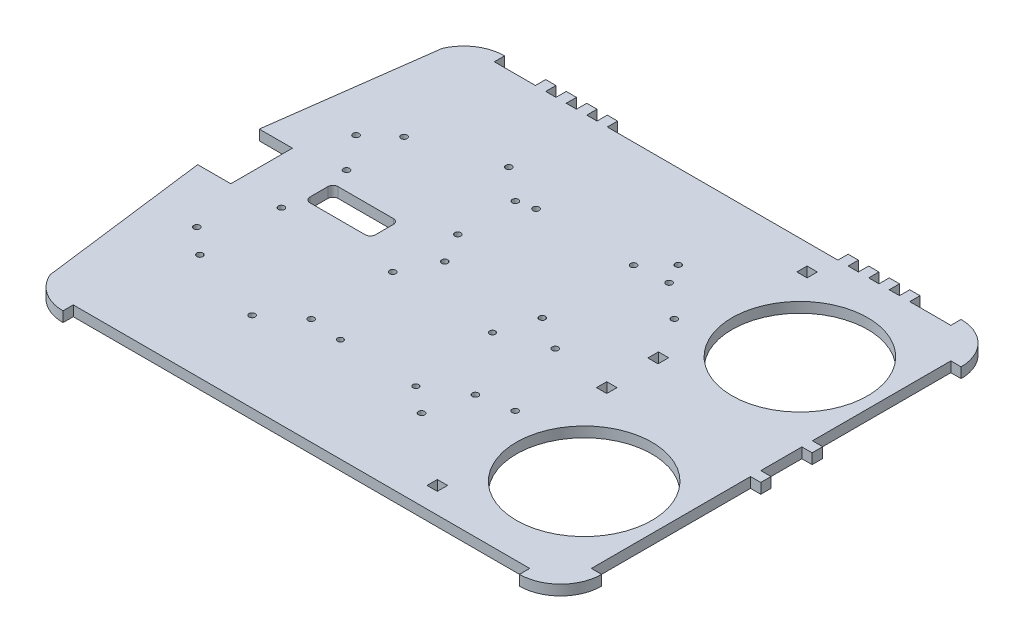
from build123d import *

# Parameters (mm, degrees)
MAIN_BASE_SKETCH_R   = 1.905
MAIN_BASE_SKETCH_R_2 = 1.796
MAIN_BASE_SKETCH_R_3 = 41.91
MAIN_BASE_SKETCH_W   = 6.302603838
MAIN_BASE_SKETCH_H   = 6.555527471
MAIN_BASE_SKETCH_W_2 = 6.35
MAIN_BASE_SKETCH_H_2 = 6.35
MAIN_BASE_DEPTH      = 6.35


with BuildPart() as part:
    # main_base_sketch → main_base (new body)
    with BuildSketch(Plane(origin=(0, 0, 0), x_dir=(1, 0, 0), z_dir=(0, 1, 0))):
        with BuildLine():
            Line((-111.125, 15.160435585), (-131.612183829, 15.160435585))
            Line((-131.612183829, 15.160435585), (-118.23996211, 114.984413257))
            ThreePointArc((-118.23996211, 114.984413257), (-108.872589459, 126.074134933), (-94.961375831, 130.222355351))
            Line((-94.961375831, 130.222355351), (-94.961375831, 123.872355351))
            Line((-94.961375831, 123.872355351), (-69.561375831, 123.872355351))
            Line((-69.561375831, 123.872355351), (-69.561375831, 130.222355351))
            Line((-69.561375831, 130.222355351), (-63.211375831, 130.222355351))
            Line((-63.211375831, 130.222355351), (-63.211375831, 123.872355351))
            Line((-63.211375831, 123.872355351), (-56.861375831, 123.872355351))
            Line((-56.861375831, 123.872355351), (-56.861375831, 130.222355351))
            Line((-56.861375831, 130.222355351), (-50.511375831, 130.222355351))
            Line((-50.511375831, 130.222355351), (-50.511375831, 123.872355351))
            Line((-50.511375831, 123.872355351), (-44.161375831, 123.872355351))
            Line((-44.161375831, 123.872355351), (-44.161375831, 130.222355351))
            Line((-44.161375831, 130.222355351), (-37.811375831, 130.222355351))
            Line((-37.811375831, 130.222355351), (-37.811375831, 123.872355351))
            Line((-37.811375831, 123.872355351), (-31.461375831, 123.872355351))
            Line((-31.461375831, 123.872355351), (-31.461375831, 130.222355351))
            Line((-31.461375831, 130.222355351), (-25.111375831, 130.222355351))
            Line((-25.111375831, 130.222355351), (-25.111375831, 123.872355351))
            Line((-25.111375831, 123.872355351), (117.475, 123.872355351))
            Line((117.475, 123.872355351), (117.475, 130.222355351))
            Line((117.475, 130.222355351), (123.825, 130.222355351))
            Line((123.825, 130.222355351), (123.825, 123.872355351))
            Line((123.825, 123.872355351), (130.175, 123.872355351))
            Line((130.175, 123.872355351), (130.175, 130.222355351))
            Line((130.175, 130.222355351), (136.525, 130.222355351))
            Line((136.525, 130.222355351), (136.525, 123.872355351))
            Line((136.525, 123.872355351), (142.875, 123.872355351))
            Line((142.875, 123.872355351), (142.875, 130.222355351))
            Line((142.875, 130.222355351), (149.225, 130.222355351))
            Line((149.225, 130.222355351), (149.225, 123.872355351))
            Line((149.225, 123.872355351), (155.575, 123.872355351))
            Line((155.575, 123.872355351), (155.575, 130.222355351))
            Line((155.575, 130.222355351), (161.925, 130.222355351))
            Line((161.925, 130.222355351), (161.925, 123.872355351))
            Line((161.925, 123.872355351), (187.325, 123.872355351))
            Line((187.325, 123.872355351), (187.325, 130.222355351))
            ThreePointArc((187.325, 130.222355351), (205.285512242, 122.782867593), (212.725, 104.822355351))
            Line((212.725, 104.822355351), (206.375, 104.822355351))
            Line((206.375, 104.822355351), (206.375, 24.179190074))
            Line((206.375, 24.179190074), (206.375, 19.255527471))
            Line((206.375, 19.255527471), (212.725, 19.255527471))
            Line((212.725, 19.255527471), (212.725, 12.7))
            Line((212.725, 12.7), (206.375, 12.7))
            Line((206.375, 12.7), (206.375, -12.7))
            Line((206.375, -12.7), (212.725, -12.7))
            Line((212.725, -12.7), (212.725, -19.05))
            Line((212.725, -19.05), (206.375, -19.05))
            Line((206.375, -19.05), (206.375, -117.475))
            Line((206.375, -117.475), (212.725, -117.475))
            ThreePointArc((212.725, -117.475), (205.285512242, -135.435512242), (187.325, -142.875))
            Line((187.325, -142.875), (187.325, -136.525))
            Line((187.325, -136.525), (-94.961375831, -136.525))
            Line((-94.961375831, -136.525), (-94.961375831, -142.875))
            ThreePointArc((-94.961375831, -142.875), (-108.899852662, -138.708908346), (-118.265969493, -127.577272727))
            Line((-118.265969493, -127.577272727), (-131.612183829, -22.939564415))
            Line((-131.612183829, -22.939564415), (-111.125, -22.939564415))
            Line((-111.125, -22.939564415), (-111.125, 15.160435585))
        make_face()
        with Locations((-82.6643, 55.745700743)):
            Circle(MAIN_BASE_SKETCH_R, mode=Mode.SUBTRACT)
        with Locations((-13.8303, 55.745700743)):
            Circle(MAIN_BASE_SKETCH_R, mode=Mode.SUBTRACT)
        with Locations((-3.2843, 57.993600743)):
            Circle(MAIN_BASE_SKETCH_R, mode=Mode.SUBTRACT)
        with Locations((-13.8303, 20.1549)):
            Circle(MAIN_BASE_SKETCH_R, mode=Mode.SUBTRACT)
        with Locations((-3.2843, 1.529400743)):
            Circle(MAIN_BASE_SKETCH_R, mode=Mode.SUBTRACT)
        with Locations((-82.6643, 20.1549)):
            Circle(MAIN_BASE_SKETCH_R, mode=Mode.SUBTRACT)
        with Locations((-82.6643, -20.1549)):
            Circle(MAIN_BASE_SKETCH_R, mode=Mode.SUBTRACT)
        with Locations((-13.8303, -20.1549)):
            Circle(MAIN_BASE_SKETCH_R, mode=Mode.SUBTRACT)
        with Locations((-82.6643, -70.568499257)):
            Circle(MAIN_BASE_SKETCH_R, mode=Mode.SUBTRACT)
        with Locations((-13.8303, -70.568499257)):
            Circle(MAIN_BASE_SKETCH_R, mode=Mode.SUBTRACT)
        with Locations((6.29, -72.547599257)):
            Circle(MAIN_BASE_SKETCH_R_2, mode=Mode.SUBTRACT)
        with Locations((54.55, -74.135099257)):
            Circle(MAIN_BASE_SKETCH_R_2, mode=Mode.SUBTRACT)
        with Locations((49.47, -21.747599257)):
            Circle(MAIN_BASE_SKETCH_R_2, mode=Mode.SUBTRACT)
        with Locations((57.0407, 1.529400743)):
            Circle(MAIN_BASE_SKETCH_R, mode=Mode.SUBTRACT)
        with Locations((57.0407, 57.993600743)):
            Circle(MAIN_BASE_SKETCH_R, mode=Mode.SUBTRACT)
        with Locations((-98.425, 41.822400743)):
            Circle(MAIN_BASE_SKETCH_R, mode=Mode.SUBTRACT)
        with Locations((-34.0871, 71.963600743)):
            Circle(MAIN_BASE_SKETCH_R, mode=Mode.SUBTRACT)
        with Locations((70.6863, 71.963600743)):
            Circle(MAIN_BASE_SKETCH_R, mode=Mode.SUBTRACT)
        with Locations((98.425, 41.822400743)):
            Circle(MAIN_BASE_SKETCH_R, mode=Mode.SUBTRACT)
        with Locations((98.425, -56.645199257)):
            Circle(MAIN_BASE_SKETCH_R, mode=Mode.SUBTRACT)
        with Locations((70.6863, -86.786399257)):
            Circle(MAIN_BASE_SKETCH_R, mode=Mode.SUBTRACT)
        with Locations((-34.0871, -86.786399257)):
            Circle(MAIN_BASE_SKETCH_R, mode=Mode.SUBTRACT)
        with Locations((-98.425, -56.645199257)):
            Circle(MAIN_BASE_SKETCH_R, mode=Mode.SUBTRACT)
        with Locations((77.47, -60.325)):
            Circle(MAIN_BASE_SKETCH_R, mode=Mode.SUBTRACT)
        with Locations((77.47, 59.53125)):
            Circle(MAIN_BASE_SKETCH_R, mode=Mode.SUBTRACT)
        with Locations((77.47, -10.95375)):
            Circle(MAIN_BASE_SKETCH_R, mode=Mode.SUBTRACT)
        with Locations((157.48, 60.372355351)):
            Circle(MAIN_BASE_SKETCH_R_3, mode=Mode.SUBTRACT)
        with Locations((157.48, -73.025)):
            Circle(MAIN_BASE_SKETCH_R_3, mode=Mode.SUBTRACT)
        with Locations((114.276301919, 15.977763736)):
            Rectangle(MAIN_BASE_SKETCH_W, MAIN_BASE_SKETCH_H, mode=Mode.SUBTRACT)
        with BuildLine():
            Line((-42.259046148, -8.681650359), (-76.408932816, -8.681650359))
            ThreePointArc((-76.408932816, -8.681650359), (-78.653996846, -7.751714389), (-79.583932816, -5.506650359))
            Line((-79.583932816, -5.506650359), (-79.583932816, 5.506650359))
            ThreePointArc((-79.583932816, 5.506650359), (-78.653996846, 7.751714389), (-76.408932816, 8.681650359))
            Line((-76.408932816, 8.681650359), (-42.259046148, 8.681650359))
            ThreePointArc((-42.259046148, 8.681650359), (-40.013982118, 7.751714389), (-39.084046148, 5.506650359))
            Line((-39.084046148, 5.506650359), (-39.084046148, -5.506650359))
            ThreePointArc((-39.084046148, -5.506650359), (-40.013982118, -7.751714389), (-42.259046148, -8.681650359))
        make_face(mode=Mode.SUBTRACT)
        with Locations((114.3, -15.875)):
            Rectangle(MAIN_BASE_SKETCH_W_2, MAIN_BASE_SKETCH_H_2, mode=Mode.SUBTRACT)
        with Locations((114.3, 107.997355351)):
            Rectangle(MAIN_BASE_SKETCH_W_2, MAIN_BASE_SKETCH_H_2, mode=Mode.SUBTRACT)
        with Locations((114.3, -120.65)):
            Rectangle(MAIN_BASE_SKETCH_W_2, MAIN_BASE_SKETCH_H_2, mode=Mode.SUBTRACT)
    extrude(amount=MAIN_BASE_DEPTH)


solid = part.part
